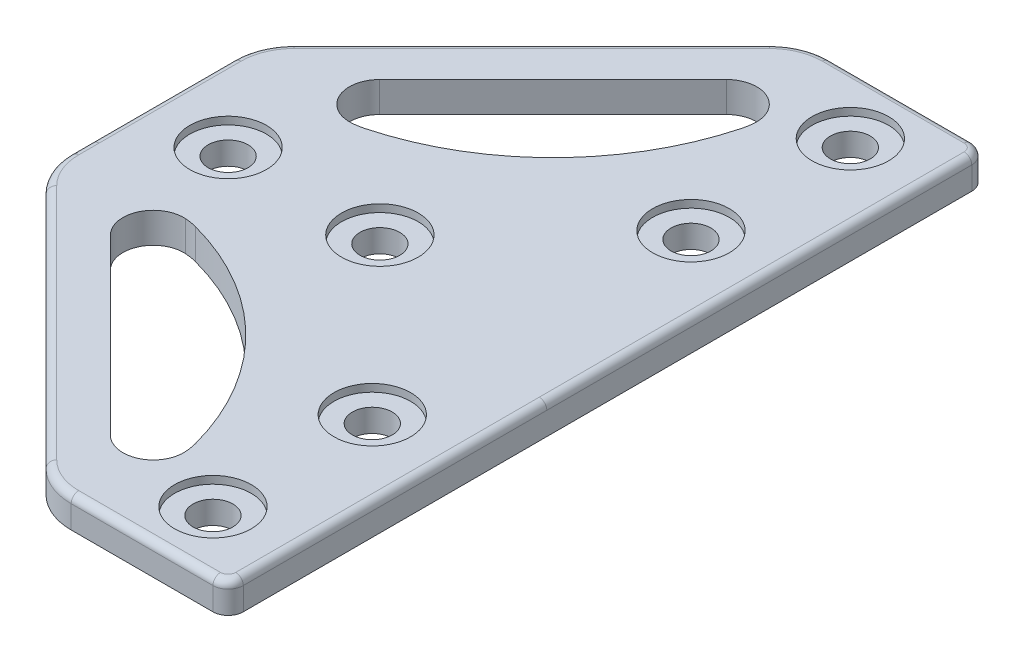
from build123d import *

# Parameters (mm, degrees)
SKETCH1_R             = 2.625
BOSS_EXTRUDE1_DEPTH   = 4
FILLET1_R             = 35
FILLET2_R             = 8
SKETCH2_R             = 5.05
CUT_EXTRUDE1_DEPTH    = 1
FILLET3_R             = 1
FILLET7_R             = 4
MIRROR1_OUTLINE_R     = 5.05
MIRROR1_DEPTH         = 4
MIRROR1_2_OUTLINE_R   = 5.05
MIRROR1_2_OUTLINE_R_2 = 2.625
MIRROR1_2_DEPTH       = 3
FILLET6_R             = 1
SKETCH3_R             = 6
BOSS_EXTRUDE2_DEPTH   = 4
FILLET8_R             = 4


with BuildPart() as part:
    # Sketch1 → Boss-Extrude1 (new body)
    with BuildSketch(Plane(origin=(0, 0, 0), x_dir=(1, 0, 0), z_dir=(0, 1, 0))):
        with BuildLine():
            Line((-0.828427125, -40), (15.171572875, -40))
            ThreePointArc((15.171572875, -40), (16.585786438, -39.414213562), (17.171572875, -38))
            Line((17.171572875, -38), (17.171572875, -10.175438596))
            Line((17.171572875, -10.175438596), (17.171572875, 18))
            ThreePointArc((17.171572875, 18), (16.585786438, 19.414213562), (15.171572875, 20))
            Line((15.171572875, 20), (-40.828427125, 20))
            ThreePointArc((-40.828427125, 20), (-42.242640687, 19.414213562), (-42.828427125, 18))
            Line((-42.828427125, 18), (-42.828427125, 2))
            Line((-42.828427125, 2), (-42.828427125, -4))
            Line((-42.828427125, -4), (-6.828427125, -40))
            Line((-6.828427125, -40), (-0.828427125, -40))
        make_face()
        with Locations(Location((-32.828427125, 10, 0), (0, 0, 270))):
            Circle(SKETCH1_R, mode=Mode.SUBTRACT)
        with Locations(Location((-12.828427125, 10, 0), (0, 0, 270))):
            Circle(SKETCH1_R, mode=Mode.SUBTRACT)
        with Locations(Location((7.171572875, -32, 0), (0, 0, 270))):
            Circle(SKETCH1_R, mode=Mode.SUBTRACT)
        with Locations(Location((7.171572875, 10, 0), (0, 0, 270))):
            Circle(SKETCH1_R, mode=Mode.SUBTRACT)
        with Locations(Location((7.171572875, -11, 0), (0, 0, 270))):
            Circle(SKETCH1_R, mode=Mode.SUBTRACT)
        Polygon((0, 0), (0, -34.343145751), (-4, -34.343145751), (-34.343145751, -4), (-34.343145751, 0), align=None, mode=Mode.SUBTRACT)
    extrude(amount=BOSS_EXTRUDE1_DEPTH)

    # Fillet1
    # the kernel refuses this fillet: 35 mm, written as the material it adds along each edge
    with BuildSketch(Plane(origin=(0, 0, 0), x_dir=(-1, 0, 0), z_dir=(0, 1, 0))) as fillet1_piece_1:
        with BuildLine():
            CenterArc((34.993835779, 35), FILLET1_R, 181.075348167, 88.924651833)
            Line((0, 34.343145751), (-0.699876716, 34.330008666))
            ThreePointArc((-0.699876716, 34.330008666), (-0.7, 17.171572875), (-0.7, 0))
            Line((-0.7, 0), (0, -0.7))
            Line((0, -0.7), (34.993835779, -0.7))
            Line((34.993835779, -0.7), (34.993835779, 0))
        make_face()
    extrude(amount=4)

    # Fillet2
    # the kernel refuses this fillet: 8 mm, written as the material it adds along each edge
    with BuildSketch(Plane(origin=(0, 0, 34.343145751), x_dir=(-0.13953759415061998, 0, -0.9902167741553647), z_dir=(0, 1, 0))) as fillet2_piece_1:
        with BuildLine():
            CenterArc((7.497620247, 7.941288924), FILLET2_R, 209.838221464, 67.107520075)
            Line((0.558150377, 3.960867097), (0, 0))
            ThreePointArc((0, 0), (4.232527559, -0.256860958), (8.465055117, 0))
        make_face()
    extrude(amount=4)
    with BuildSketch(Plane(origin=(-34.343145751, 4, 0.006049059), x_dir=(0.9902532983948017, 0, 0.13927815700322774), z_dir=(0, -1, 0))) as fillet2_piece_2:
        with BuildLine():
            CenterArc((7.49233694, 7.941371943), FILLET2_R, 209.887169965, 67.053653065)
            Line((0.556270126, 3.955023093), (0, 0))
            ThreePointArc((0, 0), (4.229545047, -0.256497749), (8.459090094, 0))
        make_face()
    extrude(amount=4)
    # the kernel refuses this fillet: 8 mm, written as the material it takes off along each edge
    with BuildSketch(Plane(origin=(-42.828427125, -8.284271247, 4), x_dir=(0.7071067811865472, 0, 0.7071067811865477), z_dir=(0, 1, 0)), Plane(origin=(-6.828427125, -8.284271247, 40), x_dir=(1, 0, 0), z_dir=(0, 1, 0))) as fillet2_2_piece_1:
        with BuildLine():
            CenterArc((FILLET2_R * 0.414213562373, FILLET2_R), FILLET2_R, 225, 45)
            Line((-FILLET2_R * 0.292893218813, FILLET2_R * 0.292893218813), (0, 0))
            Line((0, 0), (FILLET2_R * 0.414213562373, 0))
        make_face()
    extrude(amount=20.568542495, mode=Mode.SUBTRACT)

    # Sketch2 → Cut-Extrude1 (cut)
    with BuildSketch(Plane(origin=(0, 4, 0), x_dir=(1, 0, 0), z_dir=(0, 1, 0))):
        with Locations(Location((-32.828427125, 10, 0), (0, 0, 270))):
            Circle(SKETCH2_R)
        with Locations(Location((-12.828427125, 10, 0), (0, 0, 270))):
            Circle(SKETCH2_R)
        with Locations(Location((7.171572875, 10, 0), (0, 0, 270))):
            Circle(SKETCH2_R)
        with Locations(Location((7.171572875, -11, 0), (0, 0, 270))):
            Circle(SKETCH2_R)
        with Locations(Location((7.171572875, -32, 0), (0, 0, 270))):
            Circle(SKETCH2_R)
    extrude(amount=-CUT_EXTRUDE1_DEPTH, mode=Mode.SUBTRACT)

    # Fillet3
    fillet3_edges = [part.edges().sort_by_distance(p)[0] for p in [
        (-12.828427125, 4, -20),
        (-42.242640687, 4, -19.414213562),
        (-42.828427125, 4, -8.656854249),
        (16.585786438, 4, 39.414213562),
        (17.171572875, 4, 10),
        (-24.828427125, 4, 22),
        (5.828427125, 4, 40),
        (-6.576186085, 4, 39.39103626),
        (-42.219463385, 4, 3.74775896),
        (16.585786438, 4, -19.414213562),
    ]]
    fillet(fillet3_edges, radius=FILLET3_R)

    # Fillet7
    fillet7_edges = [part.edges().sort_by_distance(p)[0] for p in [
        (-34.343145751, 2, 4),
        (-4, 2, 34.343145751),
    ]]
    fillet(fillet7_edges, radius=FILLET7_R)

    # Mirror1: read off the stored shape, not the designer's step
    # Mirror1 outline → Mirror1 (add)
    with BuildSketch(Plane(origin=(0, 0, 0), x_dir=(1, 0, 0), z_dir=(0, 1, 0))):
        with BuildLine():
            ThreePointArc((-3.514718626, 60), (-6.576186085, 59.39103626), (-9.171572875, 57.656854249))
            Line((-9.171572875, 57.656854249), (-40.485281374, 26.343145751))
            ThreePointArc((-40.485281374, 26.343145751), (-42.219463385, 23.74775896), (-42.828427125, 20.686291501))
            Line((-42.828427125, 20.686291501), (-42.828427125, 2))
            ThreePointArc((-42.828427125, 2), (-42.560477932, 1), (-41.828427125, 0.267949192))
            Line((-41.828427125, 0.267949192), (-41.828427125, -0.686291501))
            ThreePointArc((-41.828427125, -0.686291501), (-41.295583852, -3.365075528), (-39.778174593, -5.636038969))
            Line((-39.778174593, -5.636038969), (-8.464466094, -36.949747468))
            ThreePointArc((-8.464466094, -36.949747468), (-6.193502652, -38.467156728), (-3.514718626, -39))
            Line((-3.514718626, -39), (15.171572875, -39))
            ThreePointArc((15.171572875, -39), (15.878679656, -38.707106781), (16.171572875, -38))
            Line((16.171572875, -38), (16.171572875, 0.267949192))
            ThreePointArc((16.171572875, 0.267949192), (16.903623683, 1), (17.171572875, 2))
            Line((17.171572875, 2), (17.171572875, 58))
            ThreePointArc((17.171572875, 58), (16.585786438, 59.414213562), (15.171572875, 60))
            Line((15.171572875, 60), (-3.514718626, 60))
        make_face()
        with BuildLine():
            ThreePointArc((-0.926569244, -27.509231599), (-3.268603973, -31.412129037), (-7.746610443, -30.596535308))
            Line((-7.746610443, -30.596535308), (-30.592327017, -7.750818734))
            ThreePointArc((-30.592327017, -7.750818734), (-31.406448507, -3.269563854), (-27.497905753, -0.931245518))
            ThreePointArc((-27.497905753, -0.931245518), (-26.72605518, -1.020502526), (-25.966503884, -1.184215537))
            ThreePointArc((-25.966503884, -1.184215537), (-10.249403108, -10.246958736), (-1.181193425, -25.960906179))
            ThreePointArc((-1.181193425, -25.960906179), (-1.015828492, -26.728811048), (-0.926569244, -27.509231599))
        make_face(mode=Mode.SUBTRACT)
        with Locations((-32.828427125, 10)):
            Circle(MIRROR1_OUTLINE_R, mode=Mode.SUBTRACT)
        with Locations((7.171572875, -32)):
            Circle(MIRROR1_OUTLINE_R, mode=Mode.SUBTRACT)
        with Locations((-12.828427125, 10)):
            Circle(MIRROR1_OUTLINE_R, mode=Mode.SUBTRACT)
        with Locations((7.171572875, -11)):
            Circle(MIRROR1_OUTLINE_R, mode=Mode.SUBTRACT)
        with Locations((7.171572875, 10)):
            Circle(MIRROR1_OUTLINE_R, mode=Mode.SUBTRACT)
        with BuildLine():
            ThreePointArc((-25.960906179, 21.181193425), (-30.576929417, 21.327068181), (-34.343145751, 24))
            Line((-34.343145751, 24), (-4, 54.343145751))
            ThreePointArc((-4, 54.343145751), (-1.330496844, 50.57891176), (-1.184215537, 45.966503884))
            ThreePointArc((-1.184215537, 45.966503884), (-10.246958736, 30.249403108), (-25.960906179, 21.181193425))
        make_face(mode=Mode.SUBTRACT)
        with Locations((7.171572875, 31)):
            Circle(MIRROR1_OUTLINE_R, mode=Mode.SUBTRACT)
        with Locations((7.171572875, 52)):
            Circle(MIRROR1_OUTLINE_R, mode=Mode.SUBTRACT)
    extrude(amount=MIRROR1_DEPTH)

    # Mirror1 2 outline → Mirror1 2 (add)
    # profile 1 of 2: a face of its own
    with BuildSketch(Plane(origin=(0, 0, 0), x_dir=(1, 0, 0), z_dir=(0, 1, 0))):
        with Locations((7.171572875, 31)):
            Circle(MIRROR1_2_OUTLINE_R)
        with Locations((7.171572875, 31)):
            Circle(MIRROR1_2_OUTLINE_R_2, mode=Mode.SUBTRACT)
    # profile 2 of 2: a face of its own
    with BuildSketch(Plane(origin=(0, 0, 0), x_dir=(1, 0, 0), z_dir=(0, 1, 0))):
        with Locations((7.171572875, 52)):
            Circle(MIRROR1_2_OUTLINE_R)
        with Locations((7.171572875, 52)):
            Circle(MIRROR1_2_OUTLINE_R_2, mode=Mode.SUBTRACT)
    extrude(amount=MIRROR1_2_DEPTH)

    # Fillet6
    fillet6_edges = [part.edges().sort_by_distance(p)[0] for p in [
        (-42.828427125, 4, -11.34314575),
        (-42.219463385, 4, -23.74775896),
        (-24.828427125, 4, -42),
        (-6.576186085, 4, -59.39103626),
        (5.828427125, 4, -60),
        (16.585786438, 4, -59.414213563),
        (17.171572875, 4, -30),
    ]]
    fillet(fillet6_edges, radius=FILLET6_R - 0.0001)  # a hair under: the kernel refuses the full size

    # Sketch3 → Boss-Extrude2 (add)
    with BuildSketch(Plane(origin=(0, 4, 0), x_dir=(1, 0, 0), z_dir=(0, 1, 0))):
        with Locations((7.171572875, 10)):
            Circle(SKETCH3_R)
    extrude(amount=-BOSS_EXTRUDE2_DEPTH)

    # Fillet8
    fillet8_edges = [part.edges().sort_by_distance(p)[0] for p in [
        (-4, 2, -54.343145751),
        (-34.343145751, 2, -24),
    ]]
    fillet(fillet8_edges, radius=FILLET8_R)


solid = part.part
